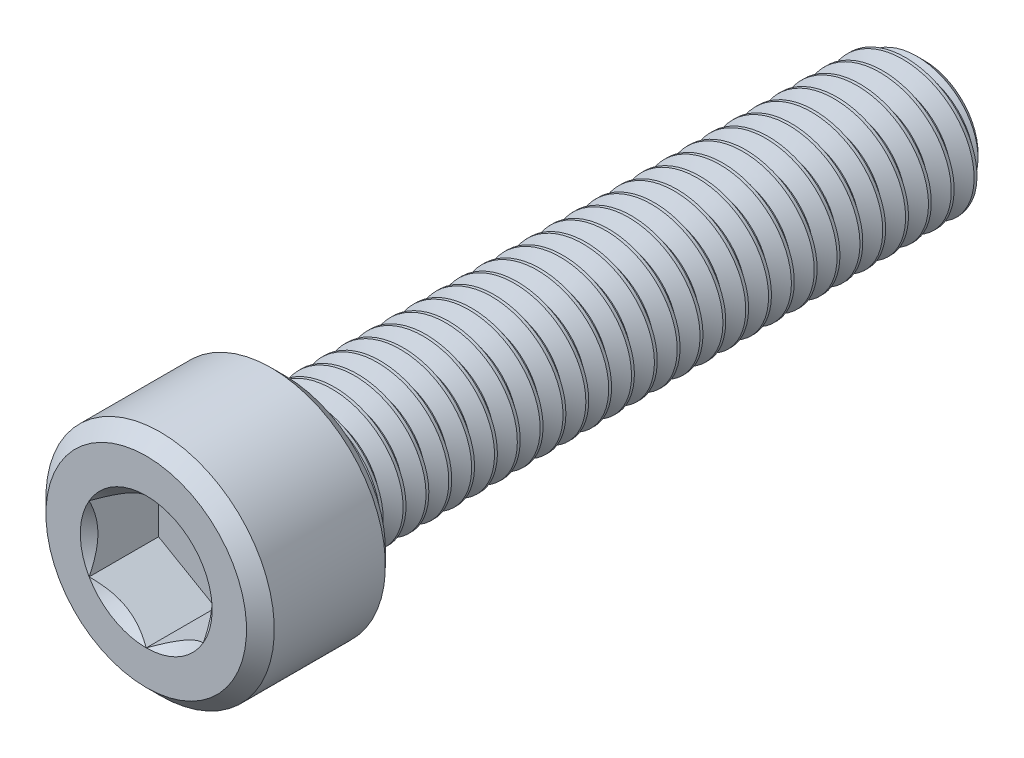
from build123d import *

# Parameters (mm, degrees)
CUT_EXTRUDE1_DEPTH = 2.413
CUT_SWEEP1_PITCH   = 0.79375
CUT_SWEEP1_TO      = 22.225


with BuildPart() as part:
    # Sketch3 → Revolve1 (revolve)
    with BuildSketch(Plane(origin=(0, 0, 0), x_dir=(0, 0, -1), z_dir=(1, 0, 0))):
        Polygon((13.5255, 0), (-13.5255, 0), (-13.5255, 3.48615), (-13.0429, 3.96875), (-9.1821, 3.96875), (-8.6995, 3.48615), (-8.6995, 2.413), (12.969875, 2.413), (13.5255, 1.857375), align=None)
    revolve(axis=Axis((0, 0, -13.5255), (0, 0, 1)))

    # Sketch4 → Cut-Extrude1 (cut)
    with BuildSketch(Plane.XY.offset(13.5255)):
        Polygon((0, -2.291358881), (1.984375, -1.14567944), (1.984375, 1.14567944), (0, 2.291358881), (-1.984375, 1.14567944), (-1.984375, -1.14567944), align=None)
    extrude(amount=-CUT_EXTRUDE1_DEPTH, mode=Mode.SUBTRACT)

    # Cut-Extrude3 cone 1 section (through the dimple's axis) → Cut-Extrude3 (revolve, cut)
    with BuildSketch(Plane(origin=(0, 0, 13.5255), x_dir=(0, -1, 0), z_dir=(1, 0, 0))):
        Polygon((0, 0), (2.291358881, 0), (0, 2.291358881), align=None)
    revolve(axis=Axis((0, 0, 13.5255), (0, 0, -1)), mode=Mode.SUBTRACT)


with BuildPart() as body_2:
    # Split1: read off the stored shape, not the designer's step
    # Split1: the piece on the far side of the plane
    add(part.part)
    split(bisect_by=Plane.XY.offset(8.6995), keep=Keep.BOTTOM)

    # Cut-Sweep1: arcs per turn and ends read off the stored shape
    # Cut-Sweep1: the profile of Sketch7 screwed along a right-hand helix through 29 turns, 8 arcs to a turn; built about Z, then put on its axis
    cut_sweep1_z = Axis((0, 0, 0), (0, 0, 1))
    cut_sweep1_corners = [(2.455962979, 0, 0.024804688), (2.455962979, 0, -0.719335938), (1.897444252, 0, -0.396875), (1.897444252, 0, -0.29765625)]
    with BuildLine(mode=Mode.PRIVATE) as cut_sweep1_profile:
        Line(cut_sweep1_corners[0], cut_sweep1_corners[1])
        Line(cut_sweep1_corners[1], cut_sweep1_corners[2])
        Line(cut_sweep1_corners[2], cut_sweep1_corners[3])
        Line(cut_sweep1_corners[3], cut_sweep1_corners[0])
    cut_sweep1_cap = Face(cut_sweep1_profile.wire())
    cut_sweep1_turn_angles = [0, 22.5, 45, 67.5, 90, 112.5, 135, 157.5, 180, 202.5, 225, 247.5, 270, 292.5, 315, 337.5, 360]
    cut_sweep1_turn_weights = [1, 0.9238795325112867, 1, 0.9238795325112867, 1, 0.9238795325112867, 1, 0.9238795325112867, 1, 0.9238795325112867, 1, 0.9238795325112867, 1, 0.9238795325112867, 1, 0.9238795325112867, 1]
    cut_sweep1_turn_rails = [Edge.make_bspline([Vector(p[0], p[1], 0).rotate(cut_sweep1_z, cut_sweep1_turn_angles[k]) / cut_sweep1_turn_weights[k] + Vector(0, 0, p[2] + CUT_SWEEP1_PITCH * cut_sweep1_turn_angles[k] / 360) for k in range(17)], [0, 0, 0, 1, 1, 2, 2, 3, 3, 4, 4, 5, 5, 6, 6, 7, 7, 8, 8, 8], 2, cut_sweep1_turn_weights) for p in cut_sweep1_corners]
    cut_sweep1_turn_sides = [Face.make_surface_from_curves(cut_sweep1_turn_rails[p[0]], cut_sweep1_turn_rails[p[1]]) for p in [(0, 1), (1, 2), (2, 3), (3, 0)]]
    cut_sweep1 = Plane(origin=(0, 0, -13.5255), x_dir=(0, 1, 0), z_dir=(0, 0, 1)) * split(Solid(Shell([*[p.moved(Location((0, 0, CUT_SWEEP1_PITCH * i))) for i in range(29) for p in cut_sweep1_turn_sides], cut_sweep1_cap, cut_sweep1_cap.rotate(cut_sweep1_z, 10440).moved(Location((0, 0, CUT_SWEEP1_PITCH * 10440 / 360)))])), bisect_by=Plane.XY.offset(CUT_SWEEP1_TO), keep=Keep.BOTTOM, mode=Mode.PRIVATE)
    add(cut_sweep1, mode=Mode.SUBTRACT)


with BuildPart() as part_1:
    add(part.part)

    # Split1
    split(bisect_by=Plane.XY.offset(8.6995), keep=Keep.TOP)

    add(body_2.part)  # Boss-Extrude1 merges body 2
    # Boss-Extrude1 cone 1 section (through the dimple's axis) → Boss-Extrude1 (revolve)
    with BuildSketch(Plane(origin=(0, 0, 8.6995), x_dir=(0, -1, 0), z_dir=(1, 0, 0))):
        Polygon((0, 0), (2.413, 0), (0, 0.425477004), align=None)
    revolve(axis=Axis((0, 0, 8.6995), (0, 0, -1)))


solid = part_1.part
